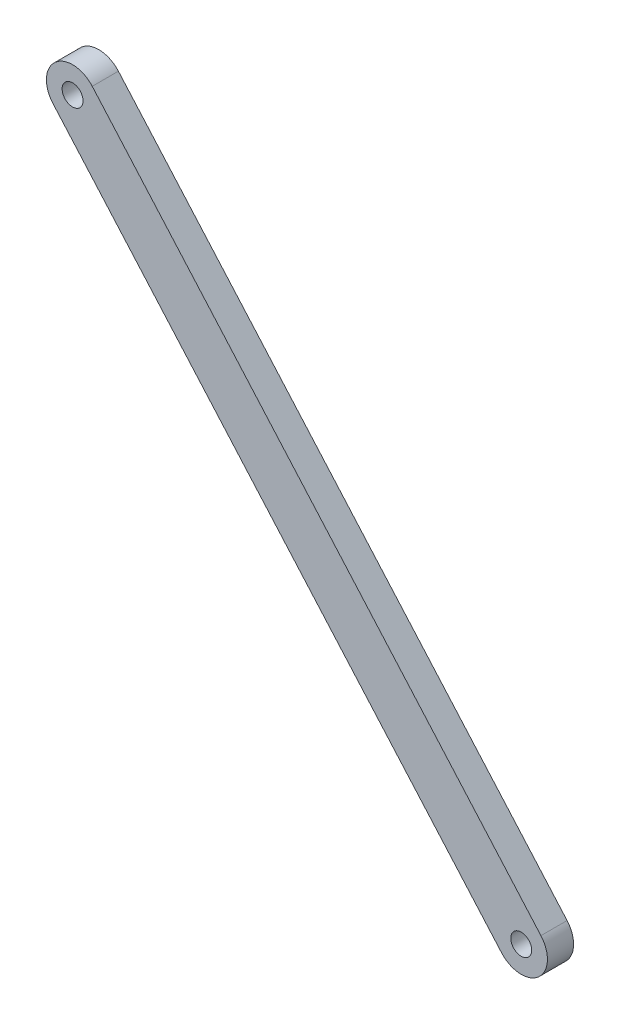
from build123d import *

# Parameters (mm, degrees)
BOSS_EXTRUDE1_START = 5
SKETCH1_R           = 2
BOSS_EXTRUDE1_DEPTH = 5


with BuildPart() as part:
    # Sketch1 → Boss-Extrude1 (new body)
    with BuildSketch(Plane.XY.offset(BOSS_EXTRUDE1_START)):
        with BuildLine():
            Line((-120.168427672, 144.524578921), (-34.41575126, 46.818496775))
            ThreePointArc((-34.41575126, 46.818496775), (-34.875497635, 39.762390677), (-41.931603733, 40.222137051))
            Line((-41.931603733, 40.222137051), (-127.684280145, 137.928219197))
            ThreePointArc((-127.684280145, 137.928219197), (-127.224533771, 144.984325295), (-120.168427672, 144.524578921))
        make_face()
        with Locations((-38.173677497, 43.520316913)):
            Circle(SKETCH1_R, mode=Mode.SUBTRACT)
        with Locations((-123.926353909, 141.226399059)):
            Circle(SKETCH1_R, mode=Mode.SUBTRACT)
    extrude(amount=BOSS_EXTRUDE1_DEPTH)


solid = part.part
